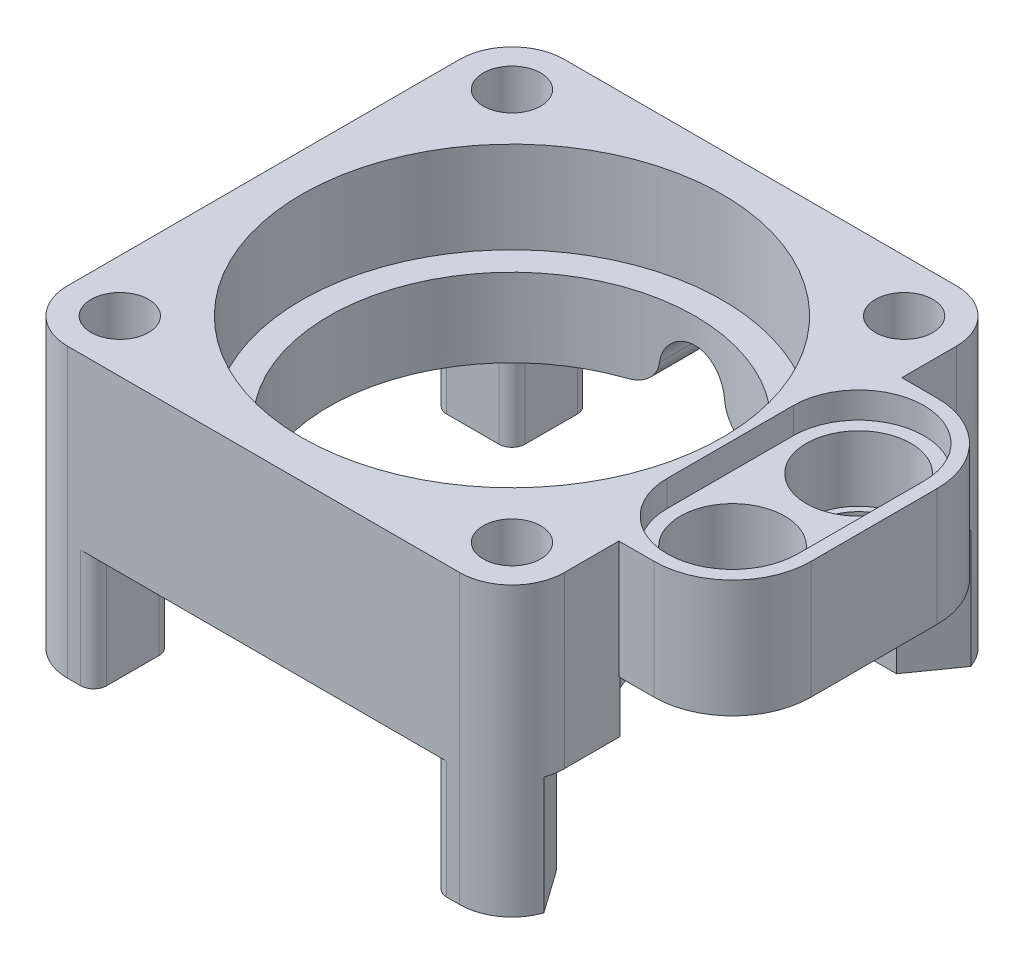
from build123d import *

# Parameters (mm, degrees)
SKETCH1_W                      = 38
SKETCH1_H                      = 38
BOSS_EXTRUDE1_DEPTH            = 22
SKETCH2_R                      = 16.1
CUT_EXTRUDE1_DEPTH             = 7
SKETCH2_3_R                    = 14
CUT_EXTRUDE3_DEPTH             = 35.727510708
FILLET1_R                      = 4
CBORE_FOR_M2_SHCS1_D           = 2.6
CBORE_FOR_M2_SHCS1_CBORE_D     = 4.4
CBORE_FOR_M2_SHCS1_CBORE_DEPTH = 5
CUT_EXTRUDE5_DEPTH             = 9
FILLET2_R                      = 1
CHAMFER1_DEPTH                 = 9
CUT_EXTRUDE6_DEPTH             = 35.727510708
FILLET3_R                      = 2
BOSS_EXTRUDE4_DEPTH            = 9
CUT_EXTRUDE8_DEPTH             = 41.150211222
SKETCH12_R                     = 4
CUT_EXTRUDE9_DEPTH             = 7
SKETCH13_R                     = 6.5
CUT_EXTRUDE11_DEPTH            = 13
CUT_EXTRUDE12_DEPTH            = 2


with BuildPart() as part:
    # Sketch1 → Boss-Extrude1 (new body)
    with BuildSketch(Plane(origin=(0, 0, 0), x_dir=(1, 0, 0), z_dir=(0, 1, 0))):
        Rectangle(SKETCH1_W, SKETCH1_H)
    extrude(amount=BOSS_EXTRUDE1_DEPTH)

    # Sketch2 → Cut-Extrude1 (cut)
    with BuildSketch(Plane(origin=(0, 22, 0), x_dir=(1, 0, 0), z_dir=(0, 1, 0))):
        with Locations(Location((0, 0, 0), (0, 0, 270))):
            Circle(SKETCH2_R)
    extrude(amount=-CUT_EXTRUDE1_DEPTH, mode=Mode.SUBTRACT)

    # Sketch2<3> → Cut-Extrude3 (cut, through all)
    with BuildSketch(Plane(origin=(0, 22, 0), x_dir=(1, 0, 0), z_dir=(0, 1, 0))):
        with Locations(Location((0, 0, 0), (0, 0, 270))):
            Circle(SKETCH2_3_R)
    extrude(amount=-CUT_EXTRUDE3_DEPTH, mode=Mode.SUBTRACT)

    # Fillet1
    fillet1_edges = [part.edges().sort_by_distance(p)[0] for p in [
        (19, 11, 19),
        (-19, 11, 19),
        (-19, 11, -19),
        (19, 11, -19),
    ]]
    fillet(fillet1_edges, radius=FILLET1_R)

    # CBORE for M2 SHCS1 (through all)
    with Locations(Plane(origin=(0, 22, 0), x_dir=(1, 0, 0), z_dir=(0, 1, 0))):
        with Locations((-15, 15), (15, 15), (-15, -15), (15, -15)):
            CounterBoreHole(CBORE_FOR_M2_SHCS1_D / 2, CBORE_FOR_M2_SHCS1_CBORE_D / 2, CBORE_FOR_M2_SHCS1_CBORE_DEPTH)

    # Sketch8 → Cut-Extrude5 (cut)
    with BuildSketch(Plane.XZ):
        Polygon((13, 13), (20, 13), (20, -13), (13, -13), (13, -20), (-13, -20), (-13, -13), (-20, -13), (-20, 13), (-13, 13), (-13, 20), (13, 20), align=None)
    extrude(amount=-CUT_EXTRUDE5_DEPTH, mode=Mode.SUBTRACT)

    # Fillet2
    fillet2_edges = [part.edges().sort_by_distance(p)[0] for p in [
        (13, 4.5, 19),
        (13, 4.5, 13),
        (13, 4.5, -19),
        (13, 4.5, -13),
        (-13, 4.5, -19),
        (-19, 4.5, -13),
        (-13, 4.5, -13),
        (-19, 4.5, 13),
        (-13, 4.5, 19),
        (-13, 4.5, 13),
    ]]
    fillet(fillet2_edges, radius=FILLET2_R)

    # Chamfer1: read off the stored shape, not the designer's step
    # Chamfer1 outline → Chamfer1 (cut)
    with BuildSketch(Plane(origin=(0, 0, 0), x_dir=(1, 0, 0), z_dir=(0, 1, 0))):
        with BuildLine():
            ThreePointArc((19, 15), (18.942394239, 15.676407915), (18.771236167, 16.333333333))
            Line((18.771236167, 16.333333333), (16.414213562, 13))
            Line((16.414213562, 13), (19, 13))
            Line((19, 13), (19, 15))
        make_face()
        with BuildLine():
            Line((19, -15), (19, -13))
            Line((19, -13), (16.414213562, -13))
            Line((16.414213562, -13), (18.771236167, -16.333333333))
            ThreePointArc((18.771236167, -16.333333333), (18.942394239, -15.676407915), (19, -15))
        make_face()
    extrude(amount=CHAMFER1_DEPTH, mode=Mode.SUBTRACT)

    # Sketch10 → Cut-Extrude6 (cut, through all)
    with BuildSketch(Plane.XY):
        with BuildLine():
            Line((2.5, 10.55), (2.5, 0))
            Line((2.5, 0), (-2.5, 0))
            Line((-2.5, 0), (-2.5, 10.55))
            ThreePointArc((-2.5, 10.55), (0, 13.05), (2.5, 10.55))
        make_face()
    extrude(amount=-CUT_EXTRUDE6_DEPTH, mode=Mode.SUBTRACT)

    # Fillet3
    fillet3_edges = [part.edges().sort_by_distance(p)[0] for p in [
        (-2.5, 9, -16.387488657),
        (2.5, 9, -16.387488657),
    ]]
    fillet(fillet3_edges, radius=FILLET3_R)

    # Sketch11 → Boss-Extrude4 (add)
    with BuildSketch(Plane(origin=(0, 22, 0), x_dir=(1, 0, 0), z_dir=(0, 1, 0))):
        with BuildLine():
            Line((19, 7.055118245), (19, 2.589962887))
            ThreePointArc((19, 2.589962887), (22.882033078, 1.529808424), (25.195477121, 4.822540566))
            ThreePointArc((25.195477121, 4.822540566), (22.882033078, 8.115272708), (19, 7.055118245))
        make_face()
        with BuildLine():
            ThreePointArc((19, 7.055118245), (18.195477121, 4.822540566), (19, 2.589962887))
            Line((19, 2.589962887), (19, 7.055118245))
        make_face()
        with BuildLine():
            Line((19, -2.589962887), (19, -7.055118245))
            ThreePointArc((19, -7.055118245), (22.882033078, -8.115272708), (25.195477121, -4.822540566))
            ThreePointArc((25.195477121, -4.822540566), (22.882033078, -1.529808424), (19, -2.589962887))
        make_face()
        with BuildLine():
            ThreePointArc((19, -2.589962887), (18.195477121, -4.822540566), (19, -7.055118245))
            Line((19, -7.055118245), (19, -2.589962887))
        make_face()
        with BuildLine():
            Line((19, -10.822540566), (21.695477121, -10.822540566))
            ThreePointArc((21.695477121, -10.822540566), (25.938117808, -9.065181253), (27.695477121, -4.822540566))
            Line((27.695477121, -4.822540566), (27.695477121, 4.822540566))
            ThreePointArc((27.695477121, 4.822540566), (25.938117808, 9.065181253), (21.695477121, 10.822540566))
            Line((21.695477121, 10.822540566), (19, 10.822540566))
            Line((19, 10.822540566), (19, 7.055118245))
            ThreePointArc((19, 7.055118245), (22.882033078, 8.115272708), (25.195477121, 4.822540566))
            ThreePointArc((25.195477121, 4.822540566), (22.882033078, 1.529808424), (19, 2.589962887))
            Line((19, 2.589962887), (19, -2.589962887))
            ThreePointArc((19, -2.589962887), (22.882033078, -1.529808424), (25.195477121, -4.822540566))
            ThreePointArc((25.195477121, -4.822540566), (22.882033078, -8.115272708), (19, -7.055118245))
            Line((19, -7.055118245), (19, -10.822540566))
        make_face()
    extrude(amount=-BOSS_EXTRUDE4_DEPTH)

    # Sketch11<5> → Cut-Extrude8 (cut, through all)
    with BuildSketch(Plane(origin=(0, 22, 0), x_dir=(1, 0, 0), z_dir=(0, 1, 0))):
        with BuildLine():
            Line((19, 7.055118245), (19, 2.589962887))
            ThreePointArc((19, 2.589962887), (22.882033078, 1.529808424), (25.195477121, 4.822540566))
            ThreePointArc((25.195477121, 4.822540566), (22.882033078, 8.115272708), (19, 7.055118245))
        make_face()
        with BuildLine():
            ThreePointArc((19, 7.055118245), (18.195477121, 4.822540566), (19, 2.589962887))
            Line((19, 2.589962887), (19, 7.055118245))
        make_face()
        with BuildLine():
            Line((19, -2.589962887), (19, -7.055118245))
            ThreePointArc((19, -7.055118245), (22.882033078, -8.115272708), (25.195477121, -4.822540566))
            ThreePointArc((25.195477121, -4.822540566), (22.882033078, -1.529808424), (19, -2.589962887))
        make_face()
        with BuildLine():
            ThreePointArc((19, -2.589962887), (18.195477121, -4.822540566), (19, -7.055118245))
            Line((19, -7.055118245), (19, -2.589962887))
        make_face()
    extrude(amount=-CUT_EXTRUDE8_DEPTH, mode=Mode.SUBTRACT)

    # Sketch12 → Cut-Extrude9 (cut)
    with BuildSketch(Plane(origin=(0, 22, 0), x_dir=(1, 0, 0), z_dir=(0, 1, 0))):
        with Locations(Location((21.695477121, -4.822540566, 0), (0, 0, 270))):
            Circle(SKETCH12_R)
        with Locations(Location((21.695477121, 4.822540566, 0), (0, 0, 270))):
            Circle(SKETCH12_R)
    extrude(amount=-CUT_EXTRUDE9_DEPTH, mode=Mode.SUBTRACT)

    # Sketch13 → Cut-Extrude11 (cut)
    with BuildSketch(Plane.XZ):
        with Locations((21.695477121, -4.822540566)):
            Circle(SKETCH13_R)
        with Locations((21.695477121, 4.822540566)):
            Circle(SKETCH13_R)
        with BuildLine():
            ThreePointArc((17.337369448, 0), (15.755035223, 2.184141418), (15.195477121, 4.822540566))
            Line((15.195477121, 4.822540566), (15.195477121, -4.822540566))
            ThreePointArc((15.195477121, -4.822540566), (15.755035223, -2.184141418), (17.337369448, 0))
        make_face()
    extrude(amount=-CUT_EXTRUDE11_DEPTH, mode=Mode.SUBTRACT)

    # Sketch15 → Cut-Extrude12 (cut)
    with BuildSketch(Plane(origin=(0, 22, 0), x_dir=(1, 0, 0), z_dir=(0, 1, 0))):
        with BuildLine():
            Line((16.695477121, -4.822540566), (16.695477121, 4.822540566))
            ThreePointArc((16.695477121, 4.822540566), (21.695477121, 9.822540566), (26.695477121, 4.822540566))
            Line((26.695477121, 4.822540566), (26.695477121, -4.822540566))
            ThreePointArc((26.695477121, -4.822540566), (21.695477121, -9.822540566), (16.695477121, -4.822540566))
        make_face()
    extrude(amount=-CUT_EXTRUDE12_DEPTH, mode=Mode.SUBTRACT)


solid = part.part
